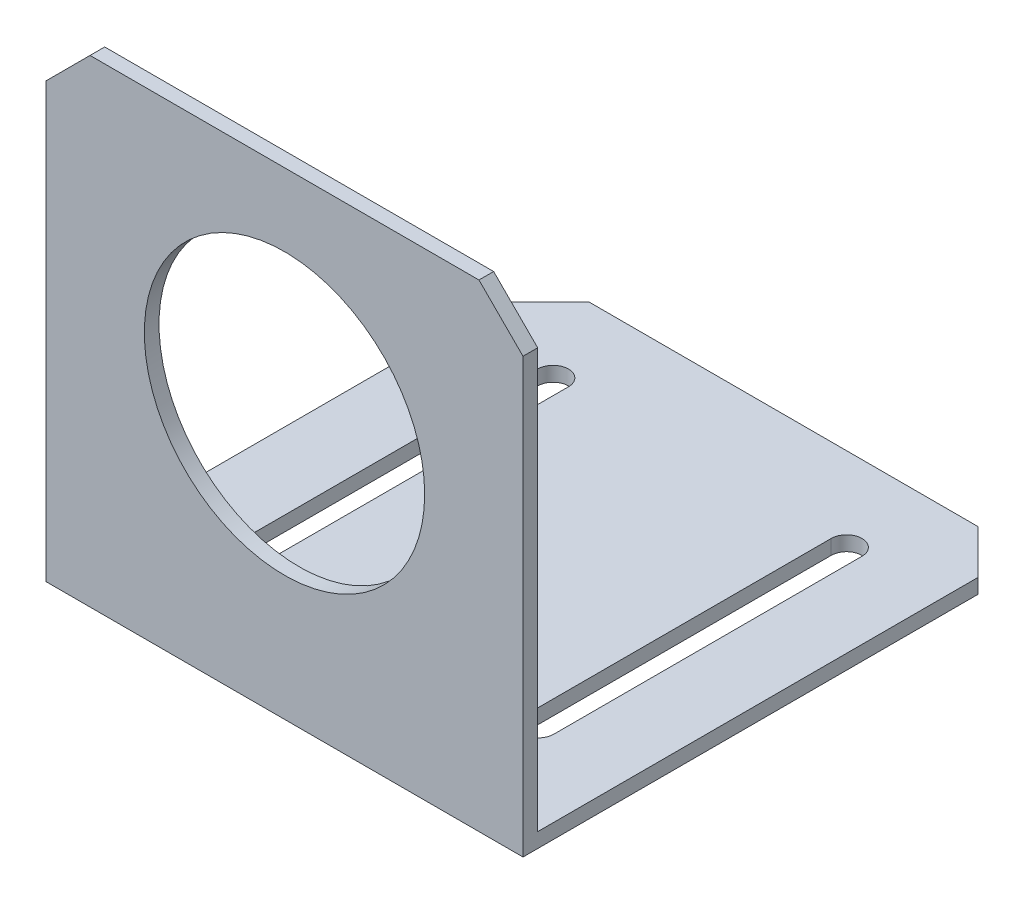
from build123d import *

# Parameters (mm, degrees)
SKETCH_1_W          = 65
SKETCH_1_H          = 65.1
SKETCH_1_R          = 19.1
EXTRUDE_1_DEPTH     = 2
SKETCH_3_W          = 66
SKETCH_3_H          = 2
EXTRUDE_2_DEPTH     = 65
CUT_EXTRUDE_2_DEPTH = 99.168157756
CHAMFER_2_SIZE      = 6
CHAMFER_3_SIZE      = 6
CHAMFER_4_SIZE      = 6
CHAMFER_5_SIZE      = 6


with BuildPart() as part:
    # 草图1 → 凸台-拉伸1 (new body)
    with BuildSketch(Plane.XY):
        with Locations((3.546875, 15.1296875)):
            Rectangle(SKETCH_1_W, SKETCH_1_H)
        with Locations((3.546875, 18.6796875)):
            Circle(SKETCH_1_R, mode=Mode.SUBTRACT)
    extrude(amount=EXTRUDE_1_DEPTH)

    # 草图3 → 凸台-拉伸2 (add)
    with BuildSketch(Plane(origin=(36.046875, 0, 0), x_dir=(0, 0, -1), z_dir=(1, 0, 0))):
        with Locations((33, -16.4203125)):
            Rectangle(SKETCH_3_W, SKETCH_3_H)
    extrude(amount=-EXTRUDE_2_DEPTH)

    # 草图4 → 切除-拉伸2 (cut, through all)
    with BuildSketch(Plane(origin=(0, -15.4203125, 0), x_dir=(1, 0, 0), z_dir=(0, 1, 0))):
        with BuildLine():
            Line((21.446875, 12.59465164), (21.446875, 54.59465164))
            ThreePointArc((21.446875, 54.59465164), (23.546875, 56.69465164), (25.646875, 54.59465164))
            Line((25.646875, 54.59465164), (25.646875, 12.59465164))
            ThreePointArc((25.646875, 12.59465164), (23.546875, 10.49465164), (21.446875, 12.59465164))
        make_face()
        with BuildLine():
            Line((-14.353125, 12.59465164), (-14.353125, 54.59465164))
            ThreePointArc((-14.353125, 54.59465164), (-16.453125, 56.69465164), (-18.553125, 54.59465164))
            Line((-18.553125, 54.59465164), (-18.553125, 12.59465164))
            ThreePointArc((-18.553125, 12.59465164), (-16.453125, 10.49465164), (-14.353125, 12.59465164))
        make_face()
    extrude(amount=-CUT_EXTRUDE_2_DEPTH, mode=Mode.SUBTRACT)

    # 倒角2
    chamfer_2_edges = [part.edges().sort_by_distance(p)[0] for p in [
        (36.046875, -16.4203125, -66),
    ]]
    chamfer(chamfer_2_edges, length=CHAMFER_2_SIZE)

    # 倒角3
    chamfer_3_edges = [part.edges().sort_by_distance(p)[0] for p in [
        (-28.953125, -16.4203125, -66),
    ]]
    chamfer(chamfer_3_edges, length=CHAMFER_3_SIZE)

    # 倒角4
    chamfer_4_edges = [part.edges().sort_by_distance(p)[0] for p in [
        (-28.953125, 47.6796875, 1),
    ]]
    chamfer(chamfer_4_edges, length=CHAMFER_4_SIZE)

    # 倒角5
    chamfer_5_edges = [part.edges().sort_by_distance(p)[0] for p in [
        (36.046875, 47.6796875, 1),
    ]]
    chamfer(chamfer_5_edges, length=CHAMFER_5_SIZE)


solid = part.part
